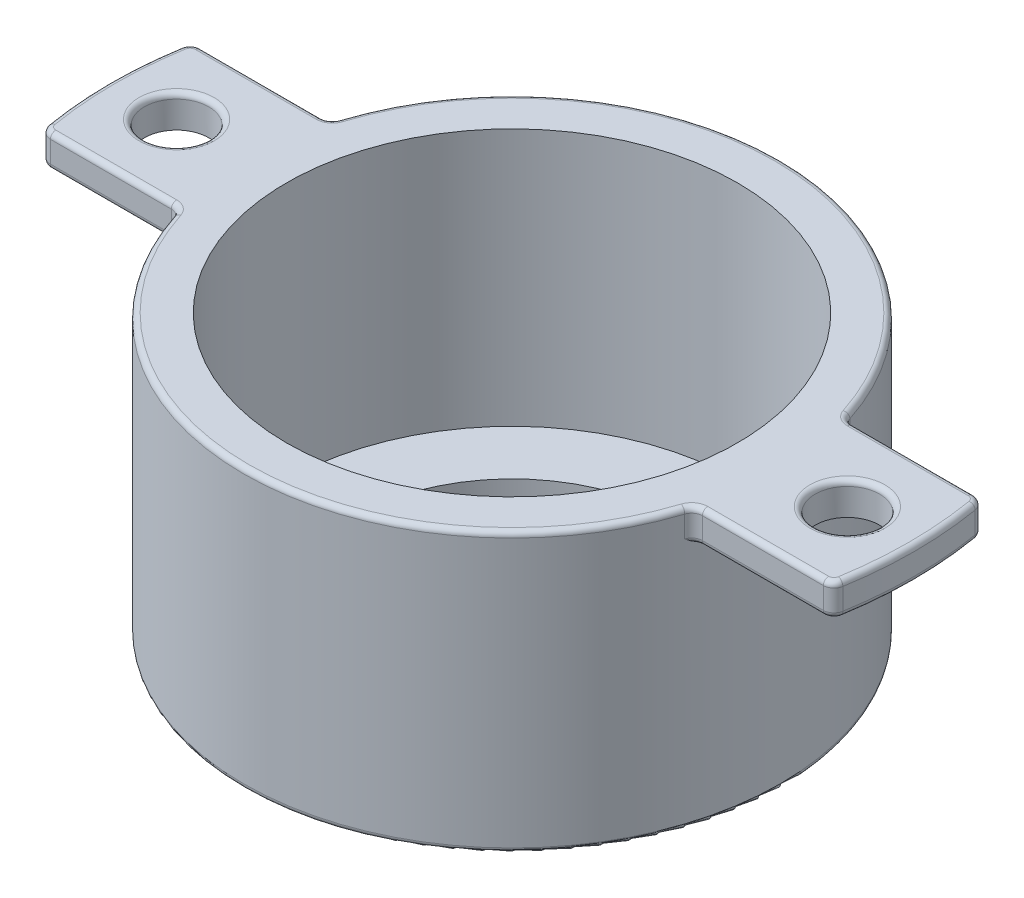
from build123d import *

# Parameters (mm, degrees)
BOSS_EXTRUDE2_START = -3
BOSS_EXTRUDE2_DEPTH = 3
SKETCH8_R           = 3
CUT_EXTRUDE2_DEPTH  = 7
FILLET_1_R          = 1
FILLET_2_R          = 0.5
FILLET_3_R          = 0.5
FILLET_4_R          = 0.5


with BuildPart() as part:
    # Sketch4 → Revolve1 (revolve)
    with BuildSketch(Plane(origin=(0, 0, 0), x_dir=(0, 0, -1), z_dir=(1, 0, 0)), mode=Mode.PRIVATE) as revolve1_sk:
        Polygon((-23.75, 26), (-25, 26), (-25, 0), (-15, 0), (-15, 2), (-21, 2), (-21, 26), align=None)
    revolve(revolve1_sk.sketch.rotate(Axis((0, -1.117924861, 0), (0, 1, 0)), 180), axis=Axis((0, -1.117924861, 0), (0, 1, 0)))

    # Sketch7 → Boss-Extrude2 (add)
    with BuildSketch(Plane(origin=(0, 26, 0), x_dir=(1, 0, 0), z_dir=(0, 1, 0)).offset(BOSS_EXTRUDE2_START)):
        with BuildLine():
            Line((-36.84087404, -7), (-24, -7))
            ThreePointArc((-24, -7), (-25, 0), (-24, 7))
            Line((-24, 7), (-36.84087404, 7))
            ThreePointArc((-36.84087404, 7), (-37.5, 0), (-36.84087404, -7))
        make_face()
        with BuildLine():
            Line((36.84087404, 7), (24, 7))
            ThreePointArc((24, 7), (25, 0), (24, -7))
            Line((24, -7), (36.84087404, -7))
            ThreePointArc((36.84087404, -7), (37.5, 0), (36.84087404, 7))
        make_face()
    extrude(amount=BOSS_EXTRUDE2_DEPTH)

    # Sketch8 → Cut-Extrude2 (cut)
    with BuildSketch(Plane(origin=(0, 26, 0), x_dir=(1, 0, 0), z_dir=(0, 1, 0))):
        with Locations(Location((31.25, 0, 0), (0, 0, 270))):
            Circle(SKETCH8_R)
        with Locations(Location((-31.25, 0, 0), (0, 0, 270))):
            Circle(SKETCH8_R)
    extrude(amount=-CUT_EXTRUDE2_DEPTH, mode=Mode.SUBTRACT)

    # 圆角1
    fillet_1_edges = [part.edges().sort_by_distance(p)[0] for p in [
        (-24, 24.5, -7),
        (-24, 24.5, 7),
        (-36.84087404, 24.5, 7),
        (-36.84087404, 24.5, -7),
        (36.84087404, 24.5, -7),
        (36.84087404, 24.5, 7),
        (24, 24.5, 7),
        (24, 24.5, -7),
    ]]
    fillet(fillet_1_edges, radius=FILLET_1_R)

    # 圆角2
    fillet_2_edges = [part.edges().sort_by_distance(p)[0] for p in [
        (-30.371052904, 26, 7),
        (0, 26, 25),
        (-14.708710135, 26, -20.215188502),
        (-37.5, 26, 0),
        (-30.371052904, 26, -7),
        (30.371052904, 26, 7),
        (37.5, 26, 0),
        (30.371052904, 26, -7),
        (36.649852917, 26, -6.763014928),
        (36.649852917, 26, 6.763014928),
        (-36.649852917, 26, -6.763014928),
        (-36.649852917, 26, 6.763014928),
        (-24.150285348, 26, 7.19139246),
        (-24.150285348, 26, -7.19139246),
        (24.150285348, 26, -7.19139246),
        (24.150285348, 26, 7.19139246),
    ]]
    fillet(fillet_2_edges, radius=FILLET_2_R)

    # 圆角3
    # the kernel refuses this fillet: 0.5 mm, written as the material it takes off along each edge
    with BuildSketch(Plane(origin=(31.25, 26, 0), x_dir=(0, 0, 1), z_dir=(-1, 0, 0))) as fillet_3_piece_1:
        with BuildLine():
            CenterArc((3 + FILLET_3_R, -FILLET_3_R), FILLET_3_R, 90, 90)
            Line((3, -FILLET_3_R), (3, 0))
            Line((3, 0), (3 + FILLET_3_R, 0))
        make_face()
    revolve(axis=Axis((31.25, 26, 0), (0, 1, 0)), mode=Mode.SUBTRACT)
    with BuildSketch(Plane(origin=(-31.25, 26, 0), x_dir=(0, 0, 1), z_dir=(-1, 0, 0))) as fillet_3_piece_2:
        with BuildLine():
            CenterArc((3 + FILLET_3_R, -FILLET_3_R), FILLET_3_R, 90, 90)
            Line((3, -FILLET_3_R), (3, 0))
            Line((3, 0), (3 + FILLET_3_R, 0))
        make_face()
    revolve(axis=Axis((-31.25, 26, 0), (0, 1, 0)), mode=Mode.SUBTRACT)
    with BuildSketch(Plane(origin=(-36.003472055, 23, 7), x_dir=(0, 0, -1), z_dir=(1, 0, 0)), Plane(origin=(-24.738633754, 23, -7), x_dir=(0, 0, 1), z_dir=(-1, 0, 0))) as fillet_3_piece_3:
        with BuildLine():
            CenterArc((FILLET_3_R, FILLET_3_R), FILLET_3_R, 180, 90)
            Line((0, FILLET_3_R), (0, 0))
            Line((0, 0), (FILLET_3_R, 0))
        make_face()
    extrude(amount=11.264838301, mode=Mode.SUBTRACT)
    with BuildSketch(Plane(origin=(0, 23, 0), x_dir=(-0.9863964946517639, 0, -0.16438356164383516), z_dir=(0.16438356164383516, 0, -0.9863964946517639))) as fillet_3_piece_4:
        with BuildLine():
            CenterArc((37.5 - FILLET_3_R, FILLET_3_R), FILLET_3_R, 270, 90)
            Line((37.5, FILLET_3_R), (37.5, 0))
            Line((37.5, 0), (37.5 - FILLET_3_R, 0))
        make_face()
    revolve(axis=Axis((0, 23, 0), (0, 1, 0)), revolution_arc=18.922852385, mode=Mode.SUBTRACT)
    with BuildSketch(Plane(origin=(-36.003472055, 23, -6), x_dir=(0, 0, -1), z_dir=(1, 0, 0))) as fillet_3_piece_5:
        with BuildLine():
            CenterArc((1 - FILLET_3_R, FILLET_3_R), FILLET_3_R, 270, 90)
            Line((1, FILLET_3_R), (1, 0))
            Line((1, 0), (1 - FILLET_3_R, 0))
        make_face()
    revolve(axis=Axis((-36.003472055, 23, -6), (0, 1, 0)), revolution_arc=80.538573807, mode=Mode.SUBTRACT)
    with BuildSketch(Plane(origin=(-36.003472055, 23, 6), x_dir=(-0.9863964946517644, 0, 0.16438356164383278), z_dir=(-0.16438356164383278, 0, -0.9863964946517644))) as fillet_3_piece_6:
        with BuildLine():
            CenterArc((1 - FILLET_3_R, FILLET_3_R), FILLET_3_R, 270, 90)
            Line((1, FILLET_3_R), (1, 0))
            Line((1, 0), (1 - FILLET_3_R, 0))
        make_face()
    revolve(axis=Axis((-36.003472055, 23, 6), (0, 1, 0)), revolution_arc=80.538573807, mode=Mode.SUBTRACT)
    with BuildSketch(Plane(origin=(36.003472055, 23, -7), x_dir=(0, 1, 0), z_dir=(-1, 0, 0)), Plane(origin=(24.738633754, 23, 7), x_dir=(0, 1, 0), z_dir=(1, 0, 0))) as fillet_3_piece_7:
        with BuildLine():
            CenterArc((FILLET_3_R, -FILLET_3_R), FILLET_3_R, 90, 90)
            Line((0, -FILLET_3_R), (0, 0))
            Line((0, 0), (FILLET_3_R, 0))
        make_face()
    extrude(amount=11.264838301, mode=Mode.SUBTRACT)
    with BuildSketch(Plane(origin=(0, 23, 0), x_dir=(0.9863964946517639, 0, 0.16438356164383516), z_dir=(-0.16438356164383516, 0, 0.9863964946517639))) as fillet_3_piece_8:
        with BuildLine():
            CenterArc((37.5 - FILLET_3_R, FILLET_3_R), FILLET_3_R, 270, 90)
            Line((37.5 - FILLET_3_R, 0), (37.5, 0))
            Line((37.5, 0), (37.5, FILLET_3_R))
        make_face()
    revolve(axis=Axis((0, 23, 0), (0, 1, 0)), revolution_arc=18.922852385, mode=Mode.SUBTRACT)
    with BuildSketch(Plane(origin=(36.003472055, 23, -6), x_dir=(0, 0, -1), z_dir=(-1, 0, 0))) as fillet_3_piece_9:
        with BuildLine():
            CenterArc((1 - FILLET_3_R, -FILLET_3_R), FILLET_3_R, 0, 90)
            Line((1 - FILLET_3_R, 0), (1, 0))
            Line((1, 0), (1, -FILLET_3_R))
        make_face()
    revolve(axis=Axis((36.003472055, 23, -6), (0, -1, 0)), revolution_arc=80.538573807, mode=Mode.SUBTRACT)
    with BuildSketch(Plane(origin=(36.003472055, 23, 6), x_dir=(0.9863964946517638, 0, 0.16438356164383625), z_dir=(0.16438356164383625, 0, -0.9863964946517638))) as fillet_3_piece_10:
        with BuildLine():
            CenterArc((1 - FILLET_3_R, -FILLET_3_R), FILLET_3_R, 0, 90)
            Line((1 - FILLET_3_R, 0), (1, 0))
            Line((1, 0), (1, -FILLET_3_R))
        make_face()
    revolve(axis=Axis((36.003472055, 23, 6), (0, -1, 0)), revolution_arc=80.538573807, mode=Mode.SUBTRACT)
    with BuildSketch(Plane(origin=(-24.738633754, 23, 8), x_dir=(0.5917604779499825, 0, 0.8061138484956132), z_dir=(-0.8061138484956132, 0, 0.5917604779499825))) as fillet_3_piece_11_section:
        with BuildLine():
            CenterArc((1 + FILLET_3_R, FILLET_3_R), FILLET_3_R, 180, 90)
            Line((1, FILLET_3_R), (1, 0))
            Line((1, 0), (1 + FILLET_3_R, 0))
        make_face()
    fillet_3_piece_11 = revolve(axis=Axis((-24.738633754, 23, 8), (0, 1, 0)), revolution_arc=143.717963168, mode=Mode.PRIVATE)
    fillet_3_piece_11 = fillet_3_piece_11 - Plane(origin=(0, 23.150919567, 0), x_dir=(0, 0, -1), z_dir=(0, -1, 0)) * Cylinder(25, 7, mode=Mode.PRIVATE)
    add(fillet_3_piece_11, mode=Mode.SUBTRACT)
    with BuildSketch(Plane(origin=(-24.738633754, 23, -8), x_dir=(0.5917604779499793, 0, -0.8061138484956154), z_dir=(-0.8061138484956154, 0, -0.5917604779499793))) as fillet_3_piece_12_section:
        with BuildLine():
            CenterArc((1 + FILLET_3_R, -FILLET_3_R), FILLET_3_R, 90, 90)
            Line((1, -FILLET_3_R), (1, 0))
            Line((1, 0), (1 + FILLET_3_R, 0))
        make_face()
    fillet_3_piece_12 = revolve(axis=Axis((-24.738633754, 23, -8), (0, -1, 0)), revolution_arc=143.717963168, mode=Mode.PRIVATE)
    fillet_3_piece_12 = fillet_3_piece_12 - Plane(origin=(0, 23.150919582, 0), x_dir=(0, 0, -1), z_dir=(0, -1, 0)) * Cylinder(25, 7, mode=Mode.PRIVATE)
    add(fillet_3_piece_12, mode=Mode.SUBTRACT)
    with BuildSketch(Plane(origin=(24.738633754, 23, -8), x_dir=(-0.5917604779499896, 0, -0.8061138484956079), z_dir=(0.8061138484956079, 0, -0.5917604779499896))) as fillet_3_piece_13_section:
        with BuildLine():
            CenterArc((1 + FILLET_3_R, FILLET_3_R), FILLET_3_R, 180, 90)
            Line((1, FILLET_3_R), (1, 0))
            Line((1, 0), (1 + FILLET_3_R, 0))
        make_face()
    fillet_3_piece_13 = revolve(axis=Axis((24.738633754, 23, -8), (0, 1, 0)), revolution_arc=143.717963168, mode=Mode.PRIVATE)
    fillet_3_piece_13 = fillet_3_piece_13 - Plane(origin=(0, 23.150919567, 0), x_dir=(0, 0, -1), z_dir=(0, -1, 0)) * Cylinder(25, 6, mode=Mode.PRIVATE)
    add(fillet_3_piece_13, mode=Mode.SUBTRACT)
    with BuildSketch(Plane(origin=(24.738633754, 23, 8), x_dir=(-0.5917604779499825, 0, 0.8061138484956132), z_dir=(0.8061138484956132, 0, 0.5917604779499825))) as fillet_3_piece_14_section:
        with BuildLine():
            CenterArc((1 + FILLET_3_R, -FILLET_3_R), FILLET_3_R, 90, 90)
            Line((1 + FILLET_3_R, 0), (1, 0))
            Line((1, 0), (1, -FILLET_3_R))
        make_face()
    fillet_3_piece_14 = revolve(axis=Axis((24.738633754, 23, 8), (0, -1, 0)), revolution_arc=143.717963168, mode=Mode.PRIVATE)
    fillet_3_piece_14 = fillet_3_piece_14 - Plane(origin=(0, 23.150919568, 0), x_dir=(0, 0, -1), z_dir=(0, -1, 0)) * Cylinder(25, 7, mode=Mode.PRIVATE)
    add(fillet_3_piece_14, mode=Mode.SUBTRACT)

    # 圆角4
    fillet_4_edges = [part.edges().sort_by_distance(p)[0] for p in [
        (0, 0, 25),
        (0, 0, 15),
    ]]
    fillet(fillet_4_edges, radius=FILLET_4_R)


solid = part.part
